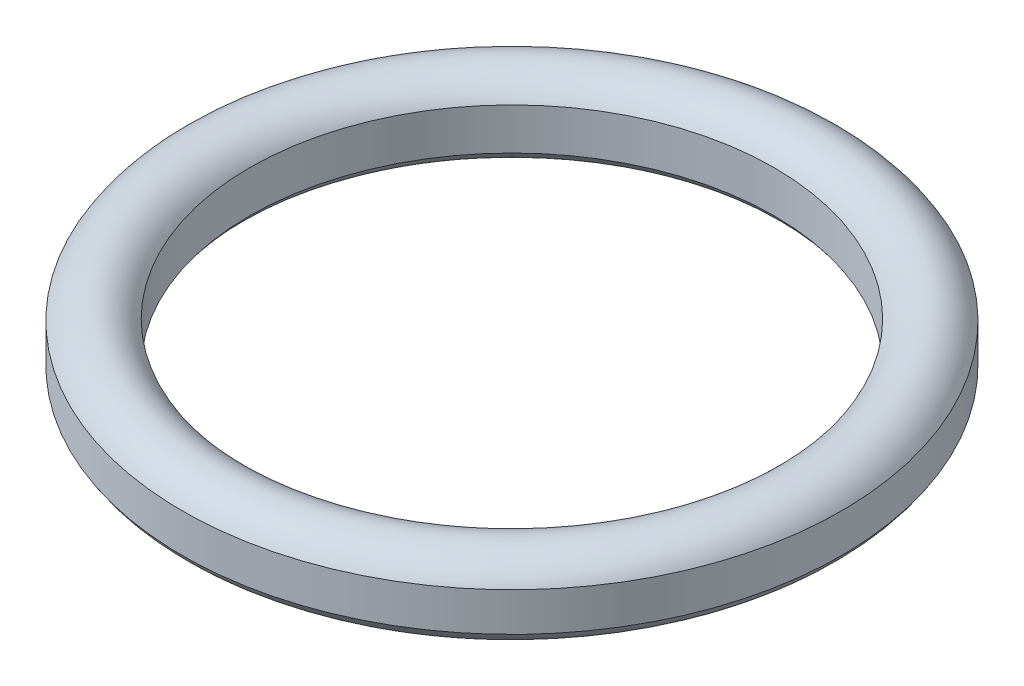
from build123d import *


with BuildPart() as part:
    # Schizzo1 → Rivoluzione1 (revolve)
    with BuildSketch(Plane.XY):
        with BuildLine():
            ThreePointArc((-11, -0.645368112), (-9.889297646, -1.309672344), (-8.75, -0.695701085))
            Line((-8.75, -0.695701085), (-8.75, 0.695701085))
            ThreePointArc((-8.75, 0.695701085), (-9.889297646, 1.309672344), (-11, 0.645368112))
            Line((-11, 0.645368112), (-11, -0.645368112))
        make_face()
    revolve(axis=Axis((0, 0, 0), (0, 1, 0)))


solid = part.part
